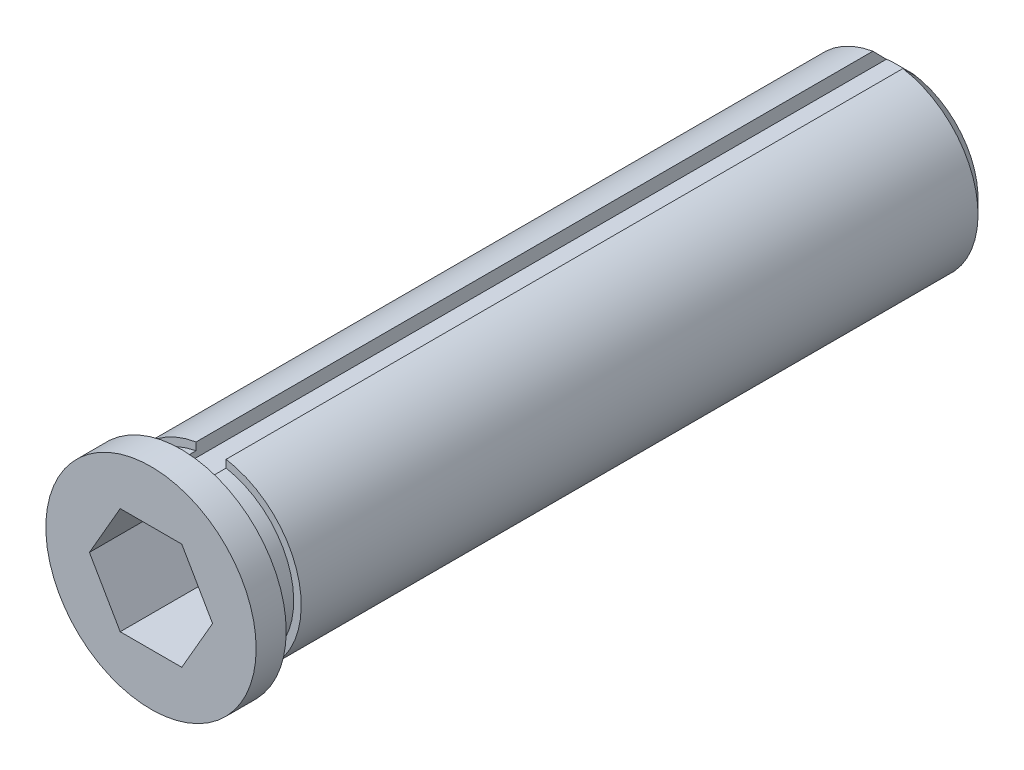
from build123d import *

# Parameters (mm, degrees)
SKETCH_1_R                        = 6
EXTRUDE_1_DEPTH                   = 50
EXTRUDE_START                     = -2
SKETCH_2_R                        = 7
SKETCH_2_R_2                      = 6
EXTRUDE_2_DEPTH                   = 2
SKETCH_3_OUTSIDE_W                = 26.756
SKETCH_3_OUTSIDE_H                = 26.756
SKETCH_3_OUTSIDE_R                = 5.5
CUT_EXTRUDE_1_DEPTH               = 2
SKETCH_6_W                        = 2
SKETCH_6_H                        = 1
CUT_EXTRUDE_1_2_DEPTH             = 2
CUT_EXTRUDE_1_2_DIRECTION_2_REACH = 52.971


# Read off the part's stored shape, not the designer's step: M12 机械螺纹 螺柱1
with BuildPart() as part:
    # 草图1 → 凸台-拉伸1 (new body)
    with BuildSketch(Plane.XY):
        Circle(SKETCH_1_R)
        Polygon((4.099186911, 0), (2.049593456, 3.55), (-2.049593456, 3.55), (-4.099186911, 0), (-2.049593456, -3.55), (2.049593456, -3.55), align=None, mode=Mode.SUBTRACT)
    extrude(amount=EXTRUDE_1_DEPTH)

    # 草图2 → 凸台-拉伸2 (add)
    with BuildSketch(Plane.XY.offset(50).offset(EXTRUDE_START)):
        Circle(SKETCH_2_R)
        Circle(SKETCH_2_R_2, mode=Mode.SUBTRACT)
    extrude(amount=EXTRUDE_2_DEPTH)

    # 草图3 outside → Cut-Extrude 1 (cut)
    with BuildSketch(Plane(origin=(0, 0, 48), x_dir=(-1, 0, 0), z_dir=(0, 0, -1))):
        Rectangle(SKETCH_3_OUTSIDE_W, SKETCH_3_OUTSIDE_H)
        Circle(SKETCH_3_OUTSIDE_R, mode=Mode.SUBTRACT)
    extrude(amount=CUT_EXTRUDE_1_DEPTH, mode=Mode.SUBTRACT)

    # M12 机械螺纹 螺柱1 outline → M12 机械螺纹 螺柱1 (revolve, cut)
    with BuildSketch(Plane.XZ):
        Polygon((6, 0.947), (5.053, 0), (6, 0), align=None)
    revolve(axis=Axis((0, 0, 0), (0, 0, 1)), mode=Mode.SUBTRACT)

    # 草图6 → Cut-Extrude 1 2 (cut)
    with BuildSketch(Plane.XY):
        with Locations((0, 5.5)):
            Rectangle(SKETCH_6_W, SKETCH_6_H)
    extrude(amount=-CUT_EXTRUDE_1_2_DEPTH, mode=Mode.SUBTRACT)

    # Cut-Extrude 1 2 direction 2: up to this face of the body (flat: up to its plane)
    cut_extrude_1_2_direction_2_end = Plane(part.part.faces().sort_by_distance((5.697989899, 0, 48))[0])
    # 草图6 → Cut-Extrude 1 2 direction 2 (cut, up to the picked face)
    with BuildSketch(Plane.XY, mode=Mode.PRIVATE) as cut_extrude_1_2_direction_2_sk1:
        with Locations((0, 5.5)):
            Rectangle(SKETCH_6_W, SKETCH_6_H)
    cut_extrude_1_2_direction_2_tool1 = split(extrude(cut_extrude_1_2_direction_2_sk1.sketch, amount=CUT_EXTRUDE_1_2_DIRECTION_2_REACH, mode=Mode.PRIVATE), bisect_by=cut_extrude_1_2_direction_2_end, keep=Keep.BOTH, mode=Mode.PRIVATE)
    add(cut_extrude_1_2_direction_2_tool1.solids().sort_by(Axis((0, 5.5, 0), (0, 0, 1)))[0], mode=Mode.SUBTRACT)


solid = part.part
